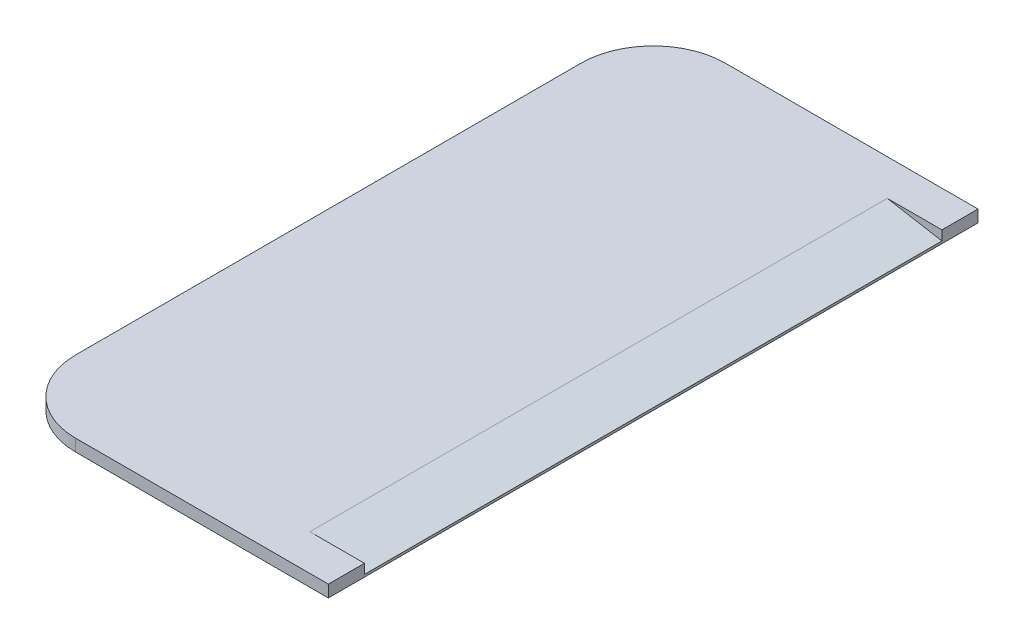
from build123d import *

# Parameters (mm, degrees)
BOSS_EXTRUDE1_DEPTH = 0.5
CUT_EXTRUDE4_DEPTH  = 24


with BuildPart() as part:
    # Sketch1 → Boss-Extrude1 (new, symmetric)
    with BuildSketch(Plane(origin=(0, 0, 0), x_dir=(1, 0, 0), z_dir=(0, 1, 0))):
        with BuildLine():
            Line((-7.5, -27), (13.5, -27))
            Line((13.5, -27), (13.5, 27))
            Line((13.5, 27), (-7.5, 27))
            ThreePointArc((-7.5, 27), (-11.742640687, 25.242640687), (-13.5, 21))
            Line((-13.5, 21), (-13.5, -21))
            ThreePointArc((-13.5, -21), (-11.742640687, -25.242640687), (-7.5, -27))
        make_face()
    extrude(amount=BOSS_EXTRUDE1_DEPTH, both=True)

    # Sketch2 → Cut-Extrude4 (cut, symmetric)
    with BuildSketch(Plane.XY):
        Polygon((13.5, -0.3), (8.962974544, 0.5), (13.5, 0.5), align=None)
    extrude(amount=CUT_EXTRUDE4_DEPTH, both=True, mode=Mode.SUBTRACT)


solid = part.part
